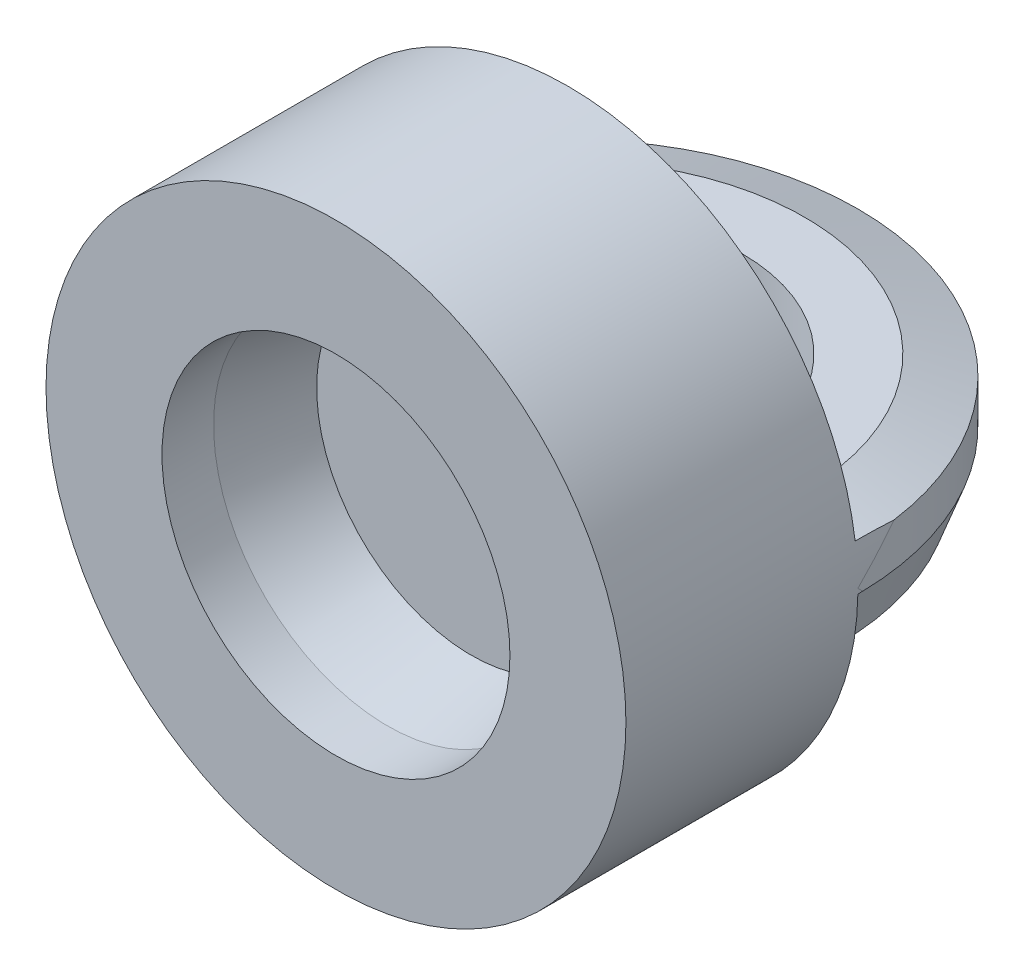
from build123d import *

# Parameters (mm, degrees)
SKETCH1_R                = 7.5
BOSS_EXTRUDE1_DEPTH      = 6
SKETCH2_R                = 4.5
CUT_EXTRUDE1_DEPTH       = 3.5
CHAMFER1_SIZE            = 0.5
CHAMFER1_SIZE2           = 2.165737937
BOSS_EXTRUDE2_DEPTH      = 1.5
BOSS_EXTRUDE2_DEPTH_BACK = 1.5
SKETCH4_OUTSIDE_W        = 22.028
SKETCH4_OUTSIDE_H        = 22.028
SKETCH4_OUTSIDE_R        = 7.5
CUT_EXTRUDE2_DEPTH       = 13.990381057
CHAMFER3_SIZE            = 1.37373871
CHAMFER3_SIZE_2          = 0.5


with BuildPart() as part:
    # Sketch1 → Boss-Extrude1 (new body)
    with BuildSketch(Plane.XY):
        Circle(SKETCH1_R)
    extrude(amount=BOSS_EXTRUDE1_DEPTH)

    # Sketch2 → Cut-Extrude1 (cut)
    with BuildSketch(Plane.XY.offset(6)):
        Circle(SKETCH2_R)
    extrude(amount=-CUT_EXTRUDE1_DEPTH, mode=Mode.SUBTRACT)

    # Chamfer1
    chamfer1_edges = [part.edges().sort_by_distance(p)[0] for p in [
        (-4.5, 0, 2.5),
    ]]
    chamfer1_side = [part.faces().sort_by_distance(p)[0] for p in [
        (0, 0, 2.5),
    ]]
    chamfer(chamfer1_edges, length=CHAMFER1_SIZE, length2=CHAMFER1_SIZE2, reference=chamfer1_side[0])

    # Sketch3 → Boss-Extrude2 (add, two sides: drawn at the far end of the back side and taken through both)
    with BuildSketch(Plane(origin=(0, 0, 0), x_dir=(1, 0, 0), z_dir=(0, 1, 0)).offset(-BOSS_EXTRUDE2_DEPTH_BACK)):
        with BuildLine():
            Line((-7.5, 0), (-4.5, 0))
            ThreePointArc((-4.5, 0), (0, 4.5), (4.5, 0))
            Line((4.5, 0), (7.5, 0))
            ThreePointArc((7.5, 0), (0, 7.5), (-7.5, 0))
        make_face()
    extrude(amount=BOSS_EXTRUDE2_DEPTH + BOSS_EXTRUDE2_DEPTH_BACK)

    # Sketch4 outside → Cut-Extrude2 (cut, through all)
    with BuildSketch(Plane.XY):
        Rectangle(SKETCH4_OUTSIDE_W, SKETCH4_OUTSIDE_H)
        Circle(SKETCH4_OUTSIDE_R, mode=Mode.SUBTRACT)
    extrude(amount=-CUT_EXTRUDE2_DEPTH, mode=Mode.SUBTRACT)

    # Chamfer3
    # the kernel refuses this chamfer: 1.37373871, 0.5 mm, written as the material it takes off along each edge
    with BuildSketch(Plane(origin=(0, -1.5, 0), x_dir=(0.9625909817516988, 0, 0.27095867184923395), z_dir=(-0.27095867184923395, 0, 0.9625909817516988))) as chamfer3_piece_1_section:
        Polygon((7.5, CHAMFER3_SIZE), (7.5 - CHAMFER3_SIZE_2, 0), (7.5, 0), align=None)
    chamfer3_piece_1 = revolve(axis=Axis((0, -1.5, 0), (0, 1, 0)), revolution_arc=211.442642735, mode=Mode.PRIVATE)
    chamfer3_piece_1 = split(chamfer3_piece_1, bisect_by=Plane(origin=(0, -0.82033622, 0), z_dir=(0, 0, -1)), keep=Keep.TOP, mode=Mode.PRIVATE)
    add(chamfer3_piece_1, mode=Mode.SUBTRACT)
    with BuildSketch(Plane(origin=(0, 1.5, 0), x_dir=(0.9625909817516987, 0, 0.2709586718492343), z_dir=(-0.2709586718492343, 0, 0.9625909817516987))) as chamfer3_piece_2_section:
        Polygon((7.5 - CHAMFER3_SIZE, 0), (7.5, -CHAMFER3_SIZE_2), (7.5, 0), align=None)
    chamfer3_piece_2 = revolve(axis=Axis((0, 1.5, 0), (0, 1, 0)), revolution_arc=211.442642735, mode=Mode.PRIVATE)
    chamfer3_piece_2 = split(chamfer3_piece_2, bisect_by=Plane(origin=(0, 1.269508832, 0), z_dir=(0, 0, -1)), keep=Keep.TOP, mode=Mode.PRIVATE)
    add(chamfer3_piece_2, mode=Mode.SUBTRACT)


solid = part.part
